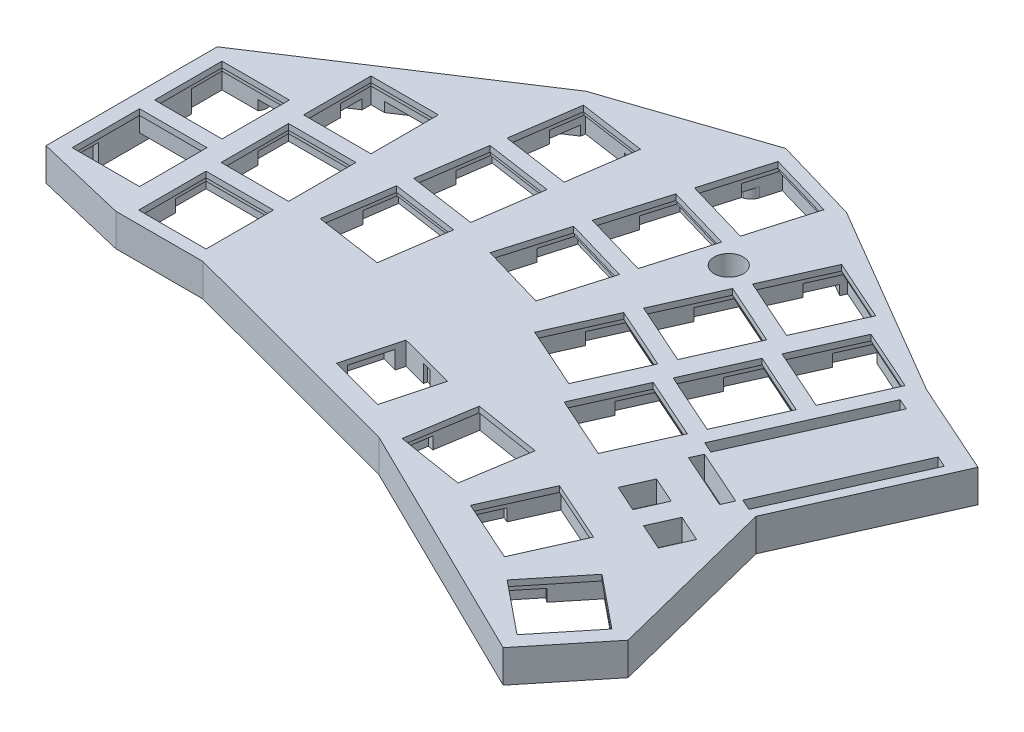
from build123d import *

# Parameters (mm, degrees)
LAYOUT_BASED_ON_OG_W     = 13.9
LAYOUT_BASED_ON_OG_H     = 13.9
LAYOUT_BASED_ON_OG_R     = 3
TOP_PLATE_DEPTH          = 1.2
BOSS_EXTRUDE2_START      = -5.5
LAYOUT_BASED_ON_OG_7_R   = 1
LAYOUT_BASED_ON_OG_7_W   = 13.9
LAYOUT_BASED_ON_OG_7_H   = 13.9
LAYOUT_BASED_ON_OG_7_R_2 = 3
BOSS_EXTRUDE2_DEPTH      = 5.5
SKETCH1_W                = 14.7
SKETCH1_H                = 14.7
CUT_EXTRUDE1_DEPTH       = 5.5
CUT_EXTRUDE2_DEPTH       = 5.7
SKETCH5_W                = 17
SKETCH5_H                = 7.4
CUT_EXTRUDE3_DEPTH       = 4.5
CUT_EXTRUDE4_DEPTH       = 2.2
SKETCH8_R                = 2.5
SKETCH8_R_2              = 2.25
CUT_EXTRUDE5_DEPTH       = 2
FILLET1_R                = 0.75


with BuildPart() as part:
    # Layout Based on OG → Top Plate (new body)
    with BuildSketch(Plane(origin=(0, 0, 0), x_dir=(1, 0, 0), z_dir=(0, 1, 0))):
        Polygon((44.932112641, 64.586160661), (-1, 34.518088786), (-1, -0.789622065), (17.882445607, -5.291259199), (35.868672805, -5.291259199), (85.361540778, -18.518913408), (135.758281381, -43.294373445), (147.28611756, -29.083818781), (138.36478836, 6.221102631), (152.486966257, 37.866376671), (133.367786474, 46.398597243), (93.420652892, 69.813076074), (75.723768858, 74.969568789), align=None)
        with Locations((9, 8.5)):
            Rectangle(LAYOUT_BASED_ON_OG_W, LAYOUT_BASED_ON_OG_H, mode=Mode.SUBTRACT)
        with Locations((27, 4.208740801)):
            Rectangle(LAYOUT_BASED_ON_OG_W, LAYOUT_BASED_ON_OG_H, mode=Mode.SUBTRACT)
        Polygon((82.42671831, -1.483486994), (79.405763835, -12.786753516), (67.812669966, -9.68833867), (70.833624441, 1.614927852), align=None, mode=Mode.SUBTRACT)
        Polygon((124.073654328, -30.793104213), (132.830543438, -19.998341913), (143.625305738, -28.755231024), (134.868416628, -39.549993323), align=None, mode=Mode.SUBTRACT)
        Polygon((106.968309305, -21.25715678), (112.632924584, -8.563767408), (125.326313955, -14.228382687), (119.661698676, -26.921772059), align=None, mode=Mode.SUBTRACT)
        Polygon((87.98288219, -16.369909233), (90.169189468, -2.642926298), (103.896172402, -4.829233576), (101.709865125, -18.55621651), align=None, mode=Mode.SUBTRACT)
        Polygon((103.849381672, 19.547250989), (116.542771044, 13.88263571), (110.878155765, 1.189246339), (98.184766393, 6.853861618), align=None, mode=Mode.SUBTRACT)
        Polygon((124.470413663, -5.2830693), (118.991252783, -2.837911626), (121.436410458, 2.641249254), (126.915571338, 0.19609158), align=None, mode=Mode.SUBTRACT)
        Polygon((133.940230051, -9.509116814), (128.461069171, -7.06395914), (130.906226845, -1.58479826), (136.385387725, -4.029955934), align=None, mode=Mode.SUBTRACT)
        Polygon((132.512214648, 4.565915741), (120.951185191, 9.725198434), (121.970000889, 12.008182134), (133.531030346, 6.848899441), align=None, mode=Mode.SUBTRACT)
        with Locations((9, 25.5)):
            Rectangle(LAYOUT_BASED_ON_OG_W, LAYOUT_BASED_ON_OG_H, mode=Mode.SUBTRACT)
        with Locations((27, 21.208740801)):
            Rectangle(LAYOUT_BASED_ON_OG_W, LAYOUT_BASED_ON_OG_H, mode=Mode.SUBTRACT)
        with Locations((27, 38.208740801)):
            Rectangle(LAYOUT_BASED_ON_OG_W, LAYOUT_BASED_ON_OG_H, mode=Mode.SUBTRACT)
        Polygon((40.2890512, 14.443567583), (42.28500861, 28.199517351), (56.040958378, 26.20355994), (54.045000968, 12.447610172), align=None, mode=Mode.SUBTRACT)
        Polygon((63.880386081, 25.872461201), (67.768842672, 39.217494185), (81.113875656, 35.329037594), (77.225419065, 21.98400461), align=None, mode=Mode.SUBTRACT)
        Polygon((42.730150191, 31.26739104), (44.726107602, 45.023340808), (58.48205737, 43.027383397), (56.486099959, 29.271433629), align=None, mode=Mode.SUBTRACT)
        Polygon((45.171249182, 48.091214497), (47.167206593, 61.847164265), (60.923156361, 59.851206854), (58.92719895, 46.095257086), align=None, mode=Mode.SUBTRACT)
        Polygon((88.345576683, 28.974928579), (101.038966054, 23.310313301), (95.374350775, 10.616923929), (82.680961404, 16.281539208), align=None, mode=Mode.SUBTRACT)
        Polygon((95.273523427, 44.499217739), (107.966912798, 38.83460246), (102.302297519, 26.141213088), (89.608908148, 31.805828367), align=None, mode=Mode.SUBTRACT)
        Polygon((110.777328416, 35.071540149), (123.470717788, 29.40692487), (117.806102509, 16.713535498), (105.112713137, 22.378150777), align=None, mode=Mode.SUBTRACT)
        Polygon((122.242660591, 13.036314755), (119.959676891, 14.055130453), (132.389228402, 41.907531592), (134.672212102, 40.888715895), align=None, mode=Mode.SUBTRACT)
        Polygon((148.826711042, 34.572058569), (136.39715953, 6.71965743), (134.11417583, 7.738473128), (146.543727342, 35.590874267), align=None, mode=Mode.SUBTRACT)
        Polygon((112.040659882, 37.902439937), (117.70527516, 50.595829308), (130.398664532, 44.93121403), (124.734049253, 32.237824658), align=None, mode=Mode.SUBTRACT)
        Polygon((72.524509006, 55.538757546), (85.86954199, 51.650300955), (81.981085399, 38.305267971), (68.636052415, 42.193724562), align=None, mode=Mode.SUBTRACT)
        with Locations((90.749335526, 48.215544602)):
            Circle(LAYOUT_BASED_ON_OG_R, mode=Mode.SUBTRACT)
        Polygon((96.536854892, 47.330117527), (102.201470171, 60.023506899), (114.894859542, 54.35889162), (109.230244263, 41.665502248), align=None, mode=Mode.SUBTRACT)
        Polygon((73.391718749, 58.514987924), (77.280175341, 71.860020908), (90.625208324, 67.971564317), (86.736751733, 54.626531333), align=None, mode=Mode.SUBTRACT)
    extrude(amount=TOP_PLATE_DEPTH)

    # Layout Based on OG<7> → Boss-Extrude2 (add)
    with BuildSketch(Plane(origin=(0, 0, 0), x_dir=(1, 0, 0), z_dir=(0, 1, 0)).offset(BOSS_EXTRUDE2_START)):
        Polygon((44.932112641, 64.586160661), (-1, 34.518088786), (-1, -0.789622065), (17.882445607, -5.291259199), (35.868672805, -5.291259199), (85.361540778, -18.518913408), (135.758281381, -43.294373445), (147.28611756, -29.083818781), (138.36478836, 6.221102631), (152.486966257, 37.866376671), (133.367786474, 46.398597243), (93.420652892, 69.813076074), (75.723768858, 74.969568789), align=None)
        with Locations((17.05, -2.008725367)):
            Circle(LAYOUT_BASED_ON_OG_7_R, mode=Mode.SUBTRACT)
        with Locations((9, 8.5)):
            Rectangle(LAYOUT_BASED_ON_OG_7_W, LAYOUT_BASED_ON_OG_7_H, mode=Mode.SUBTRACT)
        with Locations((27, 4.208740801)):
            Rectangle(LAYOUT_BASED_ON_OG_7_W, LAYOUT_BASED_ON_OG_7_H, mode=Mode.SUBTRACT)
        Polygon((82.42671831, -1.483486994), (79.405763835, -12.786753516), (67.812669966, -9.68833867), (70.833624441, 1.614927852), align=None, mode=Mode.SUBTRACT)
        with Locations((98.514300948, -21.642001273)):
            Circle(LAYOUT_BASED_ON_OG_7_R, mode=Mode.SUBTRACT)
        Polygon((124.073654328, -30.793104213), (132.830543438, -19.998341913), (143.625305738, -28.755231024), (134.868416628, -39.549993323), align=None, mode=Mode.SUBTRACT)
        Polygon((106.968309305, -21.25715678), (112.632924584, -8.563767408), (125.326313955, -14.228382687), (119.661698676, -26.921772059), align=None, mode=Mode.SUBTRACT)
        with Locations((143.005602273, -24.389532807)):
            Circle(LAYOUT_BASED_ON_OG_7_R, mode=Mode.SUBTRACT)
        Polygon((87.98288219, -16.369909233), (90.169189468, -2.642926298), (103.896172402, -4.829233576), (101.709865125, -18.55621651), align=None, mode=Mode.SUBTRACT)
        Polygon((103.849381672, 19.547250989), (116.542771044, 13.88263571), (110.878155765, 1.189246339), (98.184766393, 6.853861618), align=None, mode=Mode.SUBTRACT)
        Polygon((124.470413663, -5.2830693), (118.991252783, -2.837911626), (121.436410458, 2.641249254), (126.915571338, 0.19609158), align=None, mode=Mode.SUBTRACT)
        Polygon((133.940230051, -9.509116814), (128.461069171, -7.06395914), (130.906226845, -1.58479826), (136.385387725, -4.029955934), align=None, mode=Mode.SUBTRACT)
        Polygon((132.512214648, 4.565915741), (120.951185191, 9.725198434), (121.970000889, 12.008182134), (133.531030346, 6.848899441), align=None, mode=Mode.SUBTRACT)
        with Locations((9, 25.5)):
            Rectangle(LAYOUT_BASED_ON_OG_7_W, LAYOUT_BASED_ON_OG_7_H, mode=Mode.SUBTRACT)
        with Locations((27, 21.208740801)):
            Rectangle(LAYOUT_BASED_ON_OG_7_W, LAYOUT_BASED_ON_OG_7_H, mode=Mode.SUBTRACT)
        with Locations((5.901015243, 35.45)):
            Circle(LAYOUT_BASED_ON_OG_7_R, mode=Mode.SUBTRACT)
        with Locations((27, 38.208740801)):
            Rectangle(LAYOUT_BASED_ON_OG_7_W, LAYOUT_BASED_ON_OG_7_H, mode=Mode.SUBTRACT)
        Polygon((40.2890512, 14.443567583), (42.28500861, 28.199517351), (56.040958378, 26.20355994), (54.045000968, 12.447610172), align=None, mode=Mode.SUBTRACT)
        Polygon((63.880386081, 25.872461201), (67.768842672, 39.217494185), (81.113875656, 35.329037594), (77.225419065, 21.98400461), align=None, mode=Mode.SUBTRACT)
        Polygon((42.730150191, 31.26739104), (44.726107602, 45.023340808), (58.48205737, 43.027383397), (56.486099959, 29.271433629), align=None, mode=Mode.SUBTRACT)
        Polygon((45.171249182, 48.091214497), (47.167206593, 61.847164265), (60.923156361, 59.851206854), (58.92719895, 46.095257086), align=None, mode=Mode.SUBTRACT)
        with Locations((72.753454085, 70.801954714)):
            Circle(LAYOUT_BASED_ON_OG_7_R, mode=Mode.SUBTRACT)
        Polygon((88.345576683, 28.974928579), (101.038966054, 23.310313301), (95.374350775, 10.616923929), (82.680961404, 16.281539208), align=None, mode=Mode.SUBTRACT)
        Polygon((95.273523427, 44.499217739), (107.966912798, 38.83460246), (102.302297519, 26.141213088), (89.608908148, 31.805828367), align=None, mode=Mode.SUBTRACT)
        Polygon((110.777328416, 35.071540149), (123.470717788, 29.40692487), (117.806102509, 16.713535498), (105.112713137, 22.378150777), align=None, mode=Mode.SUBTRACT)
        Polygon((122.242660591, 13.036314755), (119.959676891, 14.055130453), (132.389228402, 41.907531592), (134.672212102, 40.888715895), align=None, mode=Mode.SUBTRACT)
        Polygon((148.826711042, 34.572058569), (136.39715953, 6.71965743), (134.11417583, 7.738473128), (146.543727342, 35.590874267), align=None, mode=Mode.SUBTRACT)
        Polygon((112.040659882, 37.902439937), (117.70527516, 50.595829308), (130.398664532, 44.93121403), (124.734049253, 32.237824658), align=None, mode=Mode.SUBTRACT)
        with Locations((145.3286298, 37.775717045)):
            Circle(LAYOUT_BASED_ON_OG_7_R, mode=Mode.SUBTRACT)
        Polygon((72.524509006, 55.538757546), (85.86954199, 51.650300955), (81.981085399, 38.305267971), (68.636052415, 42.193724562), align=None, mode=Mode.SUBTRACT)
        with Locations((90.749335526, 48.215544602)):
            Circle(LAYOUT_BASED_ON_OG_7_R_2, mode=Mode.SUBTRACT)
        Polygon((96.536854892, 47.330117527), (102.201470171, 60.023506899), (114.894859542, 54.35889162), (109.230244263, 41.665502248), align=None, mode=Mode.SUBTRACT)
        Polygon((73.391718749, 58.514987924), (77.280175341, 71.860020908), (90.625208324, 67.971564317), (86.736751733, 54.626531333), align=None, mode=Mode.SUBTRACT)
    extrude(amount=BOSS_EXTRUDE2_DEPTH)

    # Sketch1 → Cut-Extrude1 (cut)
    with BuildSketch(Plane.XZ):
        Polygon((124.936316134, -31.709536754), (130.926952436, -45.13348091), (117.50300828, -51.124117212), (111.512371978, -37.700173056), align=None)
        Polygon((118.00836939, -16.185247595), (123.999005692, -29.60919175), (110.575061536, -35.599828052), (104.584425234, -22.175883897), align=None)
        Polygon((111.080422646, -0.660958435), (117.071058948, -14.084902591), (103.647114792, -20.075538893), (97.65647849, -6.651594737), align=None)
        Polygon((95.576617656, -10.088636025), (101.567253958, -23.512580181), (88.143309802, -29.503216483), (82.1526735, -16.079272327), align=None)
        Polygon((102.5045644, -25.612925185), (108.495200702, -39.036869341), (95.071256546, -45.027505643), (89.080620244, -31.603561487), align=None)
        Polygon((109.432511144, -41.137214344), (115.423147446, -54.5611585), (101.99920329, -60.551794802), (96.008566988, -47.127850647), align=None)
        Polygon((119.863965557, 27.450059962), (125.854601859, 14.026115807), (112.430657703, 8.035479505), (106.440021401, 21.45942366), align=None)
        Polygon((144.187943189, 28.696587191), (134.927060461, 40.112630774), (123.511016877, 30.851748046), (132.771899605, 19.435704463), align=None)
        Polygon((104.354108811, 4.497127801), (102.041970899, 19.014152919), (87.524945781, 16.702015007), (89.837083693, 2.184989889), align=None)
        Polygon((86.365469748, -51.92243265), (82.253217094, -37.809340214), (68.140124658, -41.921592868), (72.252377311, -56.034685304), align=None)
        Polygon((91.121136082, -68.243696011), (87.008883428, -54.130603575), (72.895790992, -58.242856229), (77.008043646, -72.355948665), align=None)
        Polygon((61.376448654, -60.189623901), (59.265615997, -45.641964794), (44.71795689, -47.752797451), (46.828789547, -62.300456558), align=None)
        with Locations((27, -38.208740801)):
            Rectangle(SKETCH1_W, SKETCH1_H)
        Polygon((81.609803413, -35.601169288), (77.497550759, -21.488076852), (63.384458323, -25.600329506), (67.496710977, -39.713421942), align=None)
        Polygon((58.935349662, -43.365800443), (56.824517005, -28.818141336), (42.276857898, -30.928973994), (44.387690555, -45.476633101), align=None)
        Polygon((56.494250671, -26.541976986), (54.383418014, -11.994317879), (39.835758907, -14.105150536), (41.946591564, -28.652809644), align=None)
        with Locations((27, -21.208740801)):
            Rectangle(SKETCH1_W, SKETCH1_H)
        with Locations((27, -4.208740801)):
            Rectangle(SKETCH1_W, SKETCH1_H)
        with Locations((9, -8.5)):
            Rectangle(SKETCH1_W, SKETCH1_H)
        with Locations((9, -25.5)):
            Rectangle(SKETCH1_W, SKETCH1_H)
    extrude(amount=CUT_EXTRUDE1_DEPTH, mode=Mode.SUBTRACT)

    # Sketch4 → Cut-Extrude2 (cut)
    with BuildSketch(Plane.XZ.offset(5.5)):
        Polygon((75.052980345, 9.708478692), (74.381657128, 12.220315697), (72.449474817, 11.703913223), (73.120798034, 9.192076218), align=None)
        Polygon((83.02323238, 11.838638899), (75.052980345, 9.708478692), (77.118590243, 1.979749446), (85.088842277, 4.109909653), align=None)
        Polygon((77.789913459, -0.532087558), (77.118590243, 1.979749446), (75.186407931, 1.463346972), (75.857731148, -1.048490033), align=None)
        Polygon((75.186407931, 1.463346972), (73.120798034, 9.192076218), (65.150545999, 7.061916011), (67.216155897, -0.666813235), align=None)
    extrude(amount=-CUT_EXTRUDE2_DEPTH, mode=Mode.SUBTRACT)

    # Sketch5 → Cut-Extrude3 (cut)
    with BuildSketch(Plane.XZ.offset(5.5)):
        Polygon((90.476814804, -61.9215247), (92.546928385, -69.026074634), (76.225665023, -73.781740968), (74.155551443, -66.677191034), align=None)
        Polygon((80.965482135, -29.278997977), (83.035595716, -36.383547911), (66.714332355, -41.139214245), (64.644218774, -34.034664311), align=None)
        Polygon((85.72114847, -45.600261338), (87.79126205, -52.704811272), (71.469998689, -57.460477607), (69.399885108, -50.355927673), align=None)
        Polygon((113.926280704, -48.385044029), (116.941975169, -55.142675781), (101.417686009, -62.070622525), (98.401991544, -55.312990773), align=None)
        Polygon((106.99833396, -32.86075487), (110.014028425, -39.618386622), (94.489739265, -46.546333366), (91.4740448, -39.788701614), align=None)
        Polygon((100.070387216, -17.33646571), (103.086081681, -24.094097462), (87.561792521, -31.022044206), (84.546098056, -24.264412454), align=None)
        Polygon((115.574192206, -7.90878812), (118.589886671, -14.666419872), (103.065597511, -21.594366616), (100.049903046, -14.836734864), align=None)
        Polygon((122.50213895, -23.433077279), (125.517833415, -30.190709031), (109.993544255, -37.118655775), (106.97784979, -30.361024024), align=None)
        Polygon((129.430085694, -38.957366439), (132.445780159, -45.714998191), (116.921490999, -52.642944935), (113.905796534, -45.885313183), align=None)
        Polygon((61.617067964, -53.839261521), (62.679663996, -61.162572909), (45.855840539, -63.6036719), (44.793244507, -56.280360513), align=None)
        Polygon((59.175968973, -37.015438064), (60.238565005, -44.338749451), (43.414741547, -46.779848443), (42.352145516, -39.456537055), align=None)
        Polygon((56.734869982, -20.191614607), (57.797466013, -27.514925994), (40.973642556, -29.956024986), (39.911046525, -22.632713598), align=None)
        with Locations((27, -43.008740801)):
            Rectangle(SKETCH5_W, SKETCH5_H)
        with Locations((27, -26.008740801)):
            Rectangle(SKETCH5_W, SKETCH5_H)
        with Locations((9, -30.3)):
            Rectangle(SKETCH5_W, SKETCH5_H)
        with Locations((9, -3.7)):
            Rectangle(SKETCH5_W, SKETCH5_H)
        with Locations((27, -9.008740801)):
            Rectangle(SKETCH5_W, SKETCH5_H)
        Polygon((120.445482838, 28.968887685), (123.461177303, 22.211255933), (107.936888143, 15.283309189), (104.921193678, 22.040940941), align=None)
        Polygon((102.996775, 20.330720095), (104.160708371, 13.0228299), (87.372311976, 10.348928913), (86.208378605, 17.656819108), align=None)
        Polygon((135.09566148, 41.730213445), (139.757602445, 35.983361573), (126.555375172, 25.273497193), (121.893434207, 31.020349065), align=None)
    extrude(amount=-CUT_EXTRUDE3_DEPTH, mode=Mode.SUBTRACT)

    # Sketch6 → Cut-Extrude4 (cut)
    with BuildSketch(Plane.XZ.offset(5.5)):
        Polygon((137.298581205, 4.437482213), (129.993033365, 1.177271981), (127.547875691, 6.656432861), (134.853423531, 9.916643093), align=None)
        Polygon((125.383607143, 5.690595579), (127.828764818, 0.211434699), (120.523216978, -3.048775533), (118.078059304, 2.430385347), align=None)
    extrude(amount=-CUT_EXTRUDE4_DEPTH, mode=Mode.SUBTRACT)

    # Sketch8 → Cut-Extrude5 (cut)
    with BuildSketch(Plane.XZ.offset(5.5)):
        with BuildLine():
            Line((139.204412223, 23.173053982), (142.654833761, 18.919662182))
            Line((142.654833761, 18.919662182), (136.255917661, -6.403159671))
            Line((136.255917661, -6.403159671), (148.826711042, -34.572058569))
            Line((148.826711042, -34.572058569), (146.543727342, -35.590874267))
            ThreePointArc((146.543727342, -35.590874267), (144.309814103, -35.492733345), (142.890953422, -37.220979383))
            Line((142.890953422, -37.220979383), (131.019438182, -42.518821011))
            Line((131.019438182, -42.518821011), (116.921490999, -52.642944935))
            Line((116.921490999, -52.642944935), (116.434522933, -54.005566109))
            Line((116.434522933, -54.005566109), (100.910233773, -60.933512853))
            Line((100.910233773, -60.933512853), (91.752890515, -66.300967302))
            Line((91.752890515, -66.300967302), (75.431627153, -71.056633637))
            Line((75.431627153, -71.056633637), (75.153639873, -70.102592018))
            ThreePointArc((75.153639873, -70.102592018), (74.557701937, -69.071437541), (73.552294547, -68.433019528))
            Line((73.552294547, -68.433019528), (55.20726644, -62.246801008))
            Line((55.20726644, -62.246801008), (45.727060034, -62.716128839))
            Line((45.727060034, -62.716128839), (21.274106965, -46.708740801))
            Line((21.274106965, -46.708740801), (18.5, -44.892755365))
            Line((18.5, -44.892755365), (7.270371182, -37.541617631))
            ThreePointArc((7.270371182, -37.541617631), (8.357801287, -35.91281998), (7.937556428, -34))
            Line((7.937556428, -34), (1.65, -34))
            Line((1.65, -34), (1.65, -32.85))
            Line((1.65, -32.85), (1.65, -0.634659927))
            Line((1.65, -0.634659927), (19.65, -0.634659927))
            Line((19.65, -0.634659927), (34.35, 3.141259199))
            Line((34.35, 3.141259199), (35.570084054, 3.141259199))
            Line((35.570084054, 3.141259199), (86.358362209, 16.715129715))
            Line((86.358362209, 16.715129715), (100.310206629, 19.902828255))
            ThreePointArc((100.310206629, 19.902828255), (101.01123396, 21.76579762), (100.129367893, 23.55028814))
            Line((100.129367893, 23.55028814), (131.997484899, 39.216921535))
            Line((131.997484899, 39.216921535), (138.479921397, 24.066145827))
            Line((138.479921397, 24.066145827), (139.204412223, 23.173053982))
        make_face()
        with Locations((136.661892762, -29.397342614)):
            Circle(SKETCH8_R, mode=Mode.SUBTRACT)
        with Locations((131.696592578, -18.270993254)):
            Circle(SKETCH8_R, mode=Mode.SUBTRACT)
        with Locations((109.591444293, 3.388071472)):
            Circle(SKETCH8_R_2, mode=Mode.SUBTRACT)
        with BuildLine():
            Line((130.503779674, 9.848098828), (124.686737206, 7.25215643))
            ThreePointArc((124.686737206, 7.25215643), (122.045297688, 8.263490832), (123.05663209, 10.90493035))
            Line((123.05663209, 10.90493035), (128.873674557, 13.500872748))
            ThreePointArc((128.873674557, 13.500872748), (131.515114075, 12.489538346), (130.503779674, 9.848098828))
        make_face(mode=Mode.SUBTRACT)
        with BuildLine():
            Line((86.814692561, -7.850021098), (63.028921107, -14.20709784))
            ThreePointArc((63.028921107, -14.20709784), (59.968190125, -12.437373044), (61.737914921, -9.376642062))
            Line((61.737914921, -9.376642062), (85.523686375, -3.01956532))
            ThreePointArc((85.523686375, -3.01956532), (88.584417357, -4.789290116), (86.814692561, -7.850021098))
        make_face(mode=Mode.SUBTRACT)
        with BuildLine():
            Line((64.970718214, -56.485039592), (62.537305637, -45.272693234))
            ThreePointArc((62.537305637, -45.272693234), (63.685041764, -43.488680403), (65.469054595, -44.63641653))
            Line((65.469054595, -44.63641653), (67.902467172, -55.848762888))
            ThreePointArc((67.902467172, -55.848762888), (66.754731045, -57.632775719), (64.970718214, -56.485039592))
        make_face(mode=Mode.SUBTRACT)
        with BuildLine():
            Line((38.423692073, -53.453161546), (37.944396883, -46.816793128))
            ThreePointArc((37.944396883, -46.816793128), (39.332447725, -45.212637631), (40.936603222, -46.600688473))
            Line((40.936603222, -46.600688473), (41.415898413, -53.237056891))
            ThreePointArc((41.415898413, -53.237056891), (40.027847571, -54.841212388), (38.423692073, -53.453161546))
        make_face(mode=Mode.SUBTRACT)
        with BuildLine():
            Line((58.13403364, -1.541487636), (45.001022976, -5.051466566))
            ThreePointArc((45.001022976, -5.051466566), (41.940291994, -3.28174177), (43.71001679, -0.221010787))
            Line((43.71001679, -0.221010787), (56.843027454, 3.288968143))
            ThreePointArc((56.843027454, 3.288968143), (59.903758436, 1.519243347), (58.13403364, -1.541487636))
        make_face(mode=Mode.SUBTRACT)
    extrude(amount=-CUT_EXTRUDE5_DEPTH, mode=Mode.SUBTRACT)

    # Fillet1
    fillet1_edges = [part.edges().sort_by_distance(p)[0] for p in [
        (41.940291994, -3.5, -3.28174177),
        (51.567528308, -3.5, -3.296477101),
        (50.276522122, -3.5, 1.533978678),
        (59.903758436, -3.5, 1.519243347),
        (38.184044478, -3.5, -50.134977337),
        (40.027847571, -3.5, -54.841212388),
        (41.176250818, -3.5, -49.918872682),
        (39.332447725, -3.5, -45.212637631),
        (63.685041764, -3.5, -43.488680403),
        (66.685760884, -3.5, -50.242589709),
        (63.754011925, -3.5, -50.878866413),
        (66.754731045, -3.5, -57.632775719),
        (74.921806834, -3.5, -11.028559469),
        (88.584417357, -3.5, -4.789290116),
        (59.968190125, -3.5, -12.437373044),
        (73.630800648, -3.5, -6.198103691),
        (127.59525844, -3.5, 8.550127629),
        (131.515114075, -3.5, 12.489538346),
        (125.965153324, -3.5, 12.202901549),
        (122.045297688, -3.5, 8.263490832),
        (107.341444293, -3.5, 3.388071472),
        (134.161892762, -3.5, -29.397342614),
        (129.196592578, -3.5, -18.270993254),
    ]]
    fillet(fillet1_edges, radius=FILLET1_R)


solid = part.part
